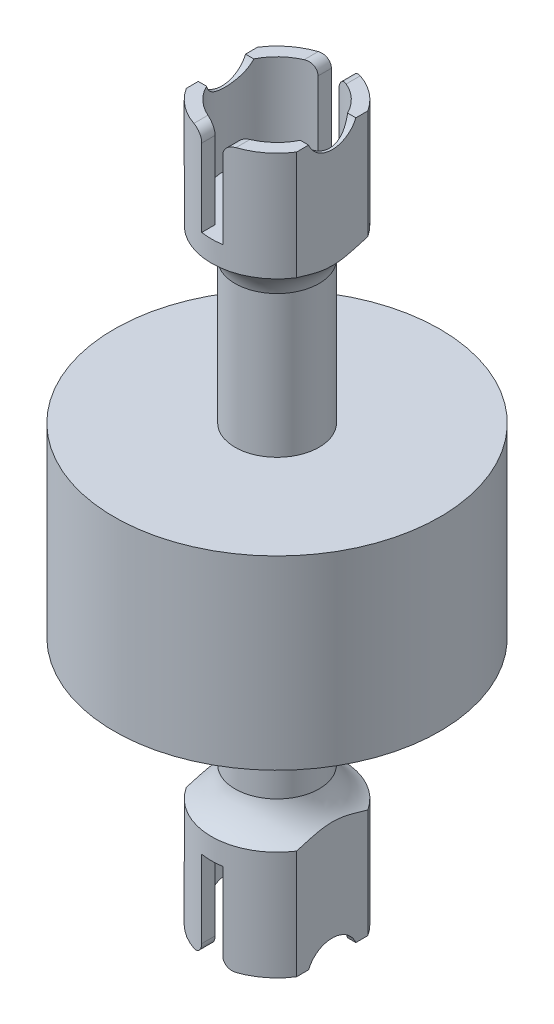
from build123d import *

# Parameters (mm, degrees)
CUT_EXTRUDE1_DEPTH      = 72.44578364
CUT_EXTRUDE1_DEPTH_BACK = 72.44578364
CUT_EXTRUDE2_START      = -8.366667
SKETCH3_R               = 5
CUT_EXTRUDE2_DEPTH      = 8.366667
SKETCH4_R               = 5
CUT_EXTRUDE3_DEPTH      = 8.366666667
CUT_EXTRUDE4_DEPTH      = 74.056912839
CUT_EXTRUDE6_START      = -5.921359641
CUT_EXTRUDE6_DEPTH      = 11.842719282
CUT_EXTRUDE9_DEPTH      = 74.056912839
SKETCH8_R               = 2
CUT_EXTRUDE10_DEPTH     = 3.5
CUT_EXTRUDE11_START     = -3.5
SKETCH10_R              = 2
CUT_EXTRUDE11_DEPTH     = 3.5


with BuildPart() as part:
    # Sketch1 → Revolve1 (revolve)
    with BuildSketch(Plane.XY, mode=Mode.PRIVATE) as revolve1_sk:
        with BuildLine():
            Line((-4, 41.333333333), (0, 41.333333333))
            Line((0, 41.333333333), (0, 59.633333333))
            Line((0, 59.633333333), (-1, 59.633333333))
            Line((-1, 59.633333333), (-1, 67))
            ThreePointArc((-1, 67), (-1.292893219, 67.707106781), (-2, 68))
            Line((-2, 68), (-6.25, 68))
            Line((-6.25, 68), (-6.25, 57.633333333))
            ThreePointArc((-6.25, 57.633333333), (-4.827742102, 56.472201287), (-4, 54.833333333))
            Line((-4, 54.833333333), (-4, 41.333333333))
        make_face()
        Polygon((-4, 23.666666667), (0, 23.666666667), (0, 41.333333333), (-4, 41.333333333), (-15.5, 41.333333333), (-15.5, 23.666666667), align=None)
        with BuildLine():
            Line((-1, 8.366666667), (0, 8.366666667))
            Line((0, 8.366666667), (0, 23.666666667))
            Line((0, 23.666666667), (-4, 23.666666667))
            Line((-4, 23.666666667), (-4, 13.166666667))
            ThreePointArc((-4, 13.166666667), (-4.827742102, 11.527798713), (-6.25, 10.366666667))
            Line((-6.25, 10.366666667), (-6.25, 0))
            Line((-6.25, 0), (-2, 0))
            ThreePointArc((-2, 0), (-1.292893219, 0.292893219), (-1, 1))
            Line((-1, 1), (-1, 8.366666667))
        make_face()
    revolve(revolve1_sk.sketch.rotate(Axis((0, 0, 0), (0, 1, 0)), 270), axis=Axis((0, 0, 0), (0, 1, 0)))

    # Sketch2 → Cut-Extrude1 (cut, two sides: drawn at the far end of the back side and taken through both)
    with BuildSketch(Plane.XY.offset(-CUT_EXTRUDE1_DEPTH_BACK)):
        with BuildLine():
            Line((1, 8.366666667), (0, 8.366666667))
            Line((0, 8.366666667), (0, 0))
            Line((0, 0), (2, 0))
            ThreePointArc((2, 0), (1.292893219, 0.292893219), (1, 1))
            Line((1, 1), (1, 8.366666667))
        make_face()
        with BuildLine():
            Line((-1, 8.366666667), (-1, 1))
            ThreePointArc((-1, 1), (-1.292893219, 0.292893219), (-2, 0))
            Line((-2, 0), (0, 0))
            Line((0, 0), (0, 8.366666667))
            Line((0, 8.366666667), (-1, 8.366666667))
        make_face()
        with BuildLine():
            Line((-1, 67), (-1, 59.633333333))
            Line((-1, 59.633333333), (1, 59.633333333))
            Line((1, 59.633333333), (1, 67))
            ThreePointArc((1, 67), (1.292893219, 67.707106781), (2, 68))
            Line((2, 68), (-2, 68))
            ThreePointArc((-2, 68), (-1.292893219, 67.707106781), (-1, 67))
        make_face()
    extrude(amount=CUT_EXTRUDE1_DEPTH + CUT_EXTRUDE1_DEPTH_BACK, mode=Mode.SUBTRACT)

    # Sketch3 → Cut-Extrude2 (cut)
    with BuildSketch(Plane(origin=(0, 68, 0), x_dir=(1, 0, 0), z_dir=(0, 1, 0)).offset(CUT_EXTRUDE2_START)):
        Circle(SKETCH3_R)
    extrude(amount=CUT_EXTRUDE2_DEPTH, mode=Mode.SUBTRACT)

    # Sketch4 → Cut-Extrude3 (cut)
    with BuildSketch(Plane.XZ):
        Circle(SKETCH4_R)
    extrude(amount=-CUT_EXTRUDE3_DEPTH, mode=Mode.SUBTRACT)

    # Sketch5 → Cut-Extrude4 (cut, through all)
    with BuildSketch(Plane.ZY.offset(6.25)):
        with BuildLine():
            ThreePointArc((0, 66.5), (1.352081728, 66.909377408), (2.25, 68))
            Line((2.25, 68), (0, 68))
            Line((0, 68), (0, 66.5))
        make_face()
        with BuildLine():
            Line((0, 66.5), (0, 68))
            Line((0, 68), (-2.25, 68))
            ThreePointArc((-2.25, 68), (-1.352081728, 66.909377408), (0, 66.5))
        make_face()
    extrude(amount=-CUT_EXTRUDE4_DEPTH, mode=Mode.SUBTRACT)

    # Cut-Extrude6: read off the stored shape, not the designer's step
    # Cut-Extrude6 outline → Cut-Extrude6 (cut)
    with BuildSketch(Plane.XY.offset(CUT_EXTRUDE6_START)):
        Polygon((5.25, 68), (5.25, 54.833333333), (7.218318328, 54.833333333), (7.218318328, 70.485772903), (5.25, 70.485772903), align=None)
        Polygon((-5.25, 68), (-5.25, 70.485772903), (-7.218318328, 70.485772903), (-7.218318328, 54.833333333), (-5.25, 54.833333333), align=None)
        Polygon((7.218318328, -1.556660257), (7.218318328, 13.166666667), (5.25, 13.166666667), (5.25, 0), (5.25, -1.556660257), align=None)
        Polygon((-5.25, 0), (-5.25, 13.166666667), (-7.218318328, 13.166666667), (-7.218318328, -1.556660257), (-5.25, -1.556660257), align=None)
    extrude(amount=CUT_EXTRUDE6_DEPTH, mode=Mode.SUBTRACT)

    # Sketch7 → Cut-Extrude9 (cut, through all)
    with BuildSketch(Plane.ZY.offset(6.25)):
        with BuildLine():
            Line((-2.25, 0), (2.25, 0))
            ThreePointArc((2.25, 0), (0, 1.5), (-2.25, 0))
        make_face()
    extrude(amount=-CUT_EXTRUDE9_DEPTH, mode=Mode.SUBTRACT)

    # Sketch8 → Cut-Extrude10 (cut)
    with BuildSketch(Plane(origin=(0, 59.633333333, 0), x_dir=(1, 0, 0), z_dir=(0, 1, 0))):
        with Locations(Location((0, 0, 0), (0, 0, 270))):
            Circle(SKETCH8_R)
    extrude(amount=-CUT_EXTRUDE10_DEPTH, mode=Mode.SUBTRACT)

    # Sketch10 → Cut-Extrude11 (cut)
    with BuildSketch(Plane.XZ.offset(-8.366666667).offset(CUT_EXTRUDE11_START)):
        with Locations(Location((0, 0, 0), (0, 0, 90))):
            Circle(SKETCH10_R)
    extrude(amount=CUT_EXTRUDE11_DEPTH, mode=Mode.SUBTRACT)


solid = part.part
